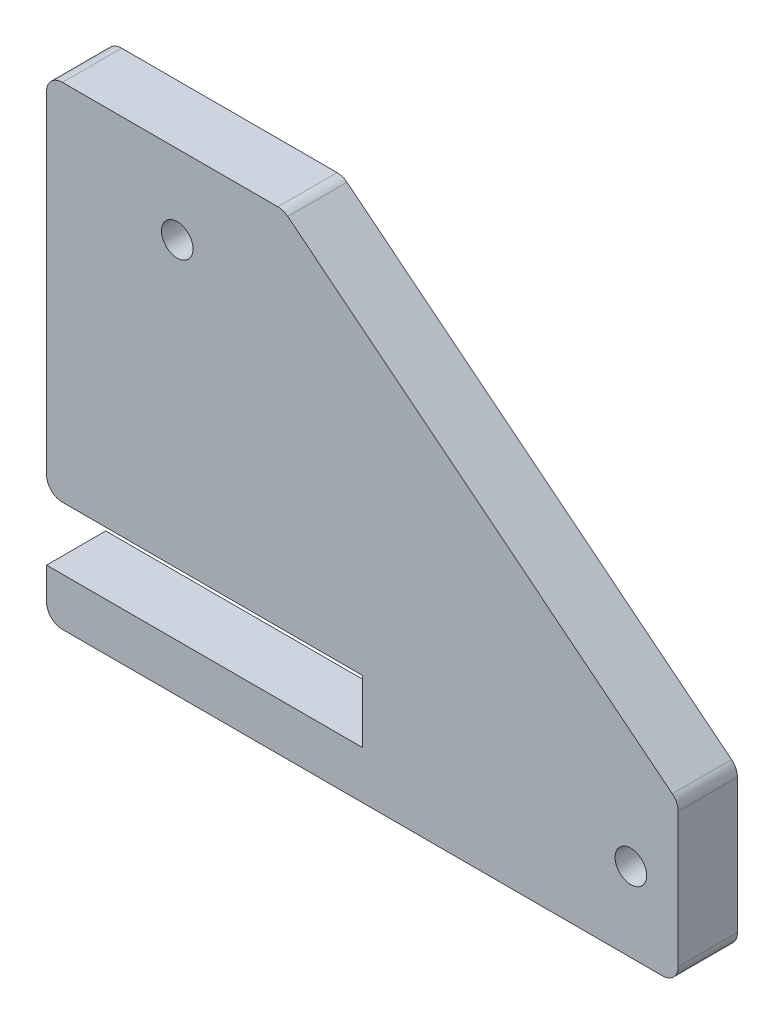
from build123d import *

# Parameters (mm, degrees)
BOSS_EXTRUDE1_DEPTH = 2.38125
SKETCH2_R           = 1.27
CUT_EXTRUDE1_DEPTH  = 41.937805342
SKETCH3_R           = 1.27
CUT_EXTRUDE2_DEPTH  = 41.937805342
CUT_EXTRUDE3_DEPTH  = 41.937805342
FILLET1_R           = 1.27


with BuildPart() as part:
    # Sketch1 → Boss-Extrude1 (new, symmetric)
    with BuildSketch(Plane.XY):
        Polygon((-25.4, 2.50825), (0, 2.50825), (0, -2.50825), (-25.4, -2.50825), (-25.4, -6.35), (25.4, -6.35), (25.4, 31.75), (-25.4, 31.75), align=None)
    extrude(amount=BOSS_EXTRUDE1_DEPTH, both=True)

    # Sketch2 → Cut-Extrude1 (cut, through all)
    with BuildSketch(Plane.XY.offset(2.38125)):
        with Locations((21.59, 0)):
            Circle(SKETCH2_R)
    extrude(amount=-CUT_EXTRUDE1_DEPTH, mode=Mode.SUBTRACT)

    # Sketch3 → Cut-Extrude2 (cut, through all)
    with BuildSketch(Plane.XY.offset(2.38125)):
        with Locations((-14.887972806, 25.4)):
            Circle(SKETCH3_R)
    extrude(amount=-CUT_EXTRUDE2_DEPTH, mode=Mode.SUBTRACT)

    # Sketch4 → Cut-Extrude3 (cut, through all)
    with BuildSketch(Plane.XY.offset(2.38125)):
        Polygon((-6.35, 31.75), (25.4, 6.35), (25.4, 31.75), align=None)
    extrude(amount=-CUT_EXTRUDE3_DEPTH, mode=Mode.SUBTRACT)

    # Fillet1
    fillet1_edges = [part.edges().sort_by_distance(p)[0] for p in [
        (-25.4, -6.35, 0),
        (25.4, -6.35, 0),
        (-25.4, 2.50825, 0),
        (-25.4, 31.75, 0),
        (25.4, 6.35, 0),
        (-6.35, 31.75, 0),
    ]]
    fillet(fillet1_edges, radius=FILLET1_R)


solid = part.part
